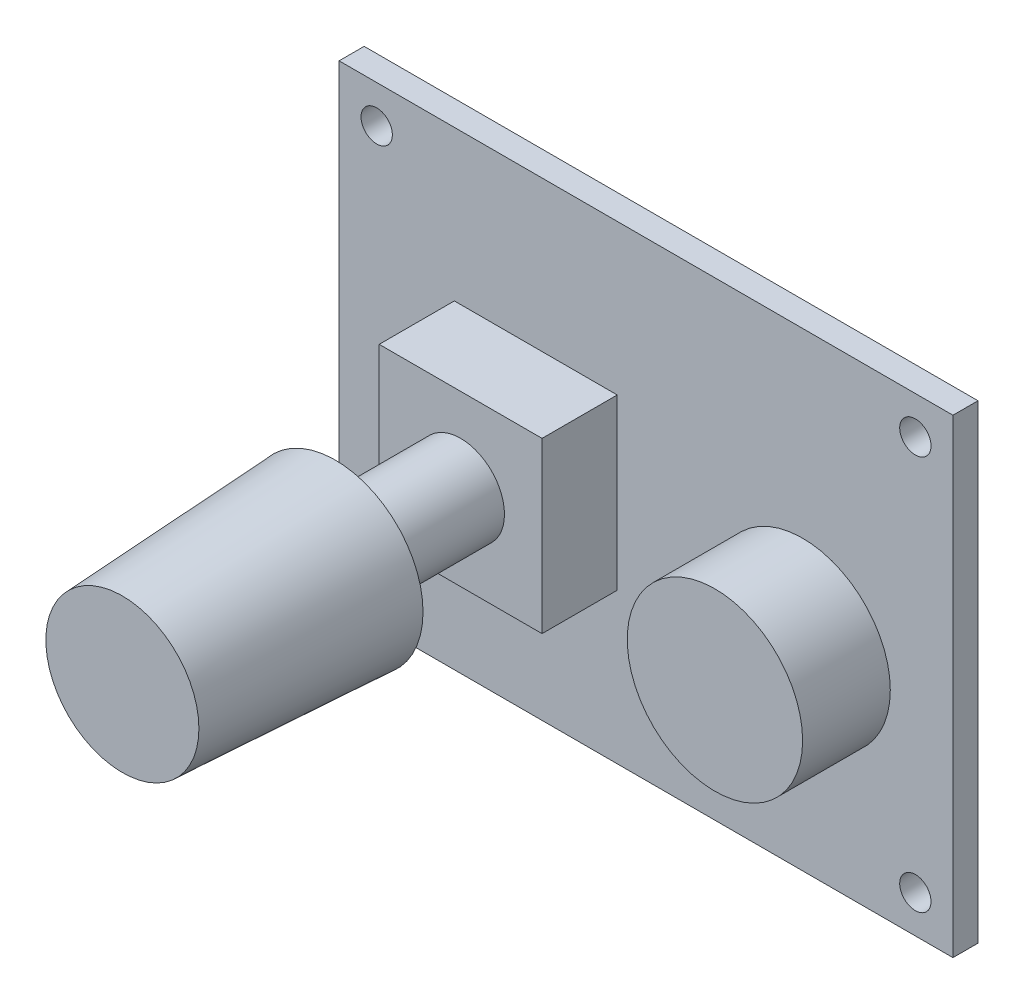
from build123d import *

# Parameters (mm, degrees)
SKETCH_1_W          = 49
SKETCH_1_H          = 37.5
EXTRUDE_1_DEPTH     = 2
SKETCH_2_R          = 1.25
CUT_EXTRUDE_1_DEPTH = 35.450757188
SKETCH_3_R          = 7
EXTRUDE_2_DEPTH     = 7
SKETCH_4_W          = 13
SKETCH_4_H          = 13.5
EXTRUDE_3_DEPTH     = 6
SKETCH_5_R          = 3.5
EXTRUDE_4_DEPTH     = 10
SKETCH_6_R          = 7
EXTRUDE_5_DEPTH     = 17
EXTRUDE_5_TAPER     = 3


with BuildPart() as part:
    # Эскиз1 → Бобышка-Вытянуть1 (new body)
    with BuildSketch(Plane.XY):
        with Locations((2.388954836, -2.693851768)):
            Rectangle(SKETCH_1_W, SKETCH_1_H)
    extrude(amount=EXTRUDE_1_DEPTH)

    # Эскиз2 → Вырез-Вытянуть1 (cut, through all)
    with BuildSketch(Plane.XY.offset(2)):
        with Locations((-19.111045164, 13.056148232)):
            Circle(SKETCH_2_R)
        with Locations((23.888954836, 13.056148232)):
            Circle(SKETCH_2_R)
        with Locations((23.888954836, -18.443851768)):
            Circle(SKETCH_2_R)
        with Locations((-19.111045164, -18.443851768)):
            Circle(SKETCH_2_R)
    extrude(amount=-CUT_EXTRUDE_1_DEPTH, mode=Mode.SUBTRACT)

    # Эскиз3 → Бобышка-Вытянуть2 (add)
    with BuildSketch(Plane.XY.offset(2)):
        with Locations((14.888954836, -5.443851768)):
            Circle(SKETCH_3_R)
    extrude(amount=EXTRUDE_2_DEPTH)

    # Эскиз4 → Бобышка-Вытянуть3 (add)
    with BuildSketch(Plane.XY.offset(2)):
        with Locations((-6.411045164, -2.693851768)):
            Rectangle(SKETCH_4_W, SKETCH_4_H)
    extrude(amount=EXTRUDE_3_DEPTH)

    # Эскиз5 → Бобышка-Вытянуть4 (add)
    with BuildSketch(Plane.XY.offset(8)):
        with Locations((-6.411045164, -2.693851768)):
            Circle(SKETCH_5_R)
    extrude(amount=EXTRUDE_4_DEPTH)

    # Эскиз6 → Бобышка-Вытянуть5 (add)
    with BuildSketch(Plane.XY.offset(18)):
        with Locations((-6.411045164, -2.693851768)):
            Circle(SKETCH_6_R)
    extrude(amount=EXTRUDE_5_DEPTH, taper=EXTRUDE_5_TAPER)


solid = part.part
